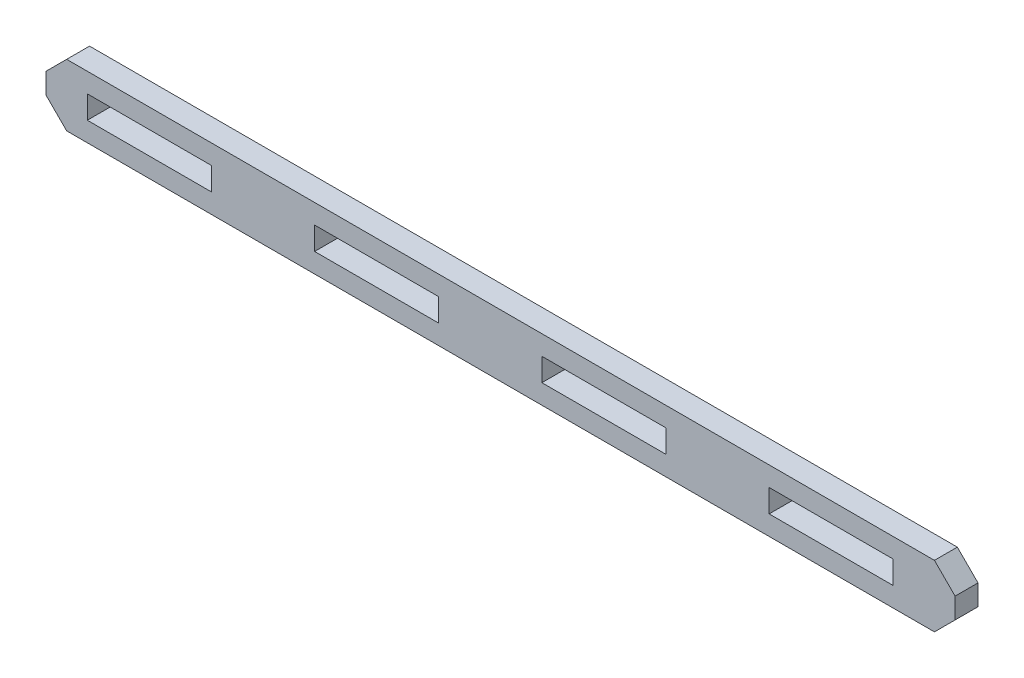
from build123d import *

# Parameters (mm, degrees)
SKETCH2_W           = 30
SKETCH2_H           = 5.54
BOSS_EXTRUDE1_DEPTH = 5.54


with BuildPart() as part:
    # Sketch2 → Boss-Extrude1 (new body)
    with BuildSketch(Plane.XY):
        Polygon((60.854830423, 15.146039761), (270.854830423, 15.146039761), (275.854830423, 10.146039761), (275.854830423, 5.146039761), (270.854830423, 0.146039761), (60.854830423, 0.146039761), (55.854830423, 5.146039761), (55.854830423, 10.146039761), align=None)
        with Locations((135.854830423, 7.646039761)):
            Rectangle(SKETCH2_W, SKETCH2_H, mode=Mode.SUBTRACT)
        with Locations((80.854830423, 7.646039761)):
            Rectangle(SKETCH2_W, SKETCH2_H, mode=Mode.SUBTRACT)
        with Locations((190.854830423, 7.646039761)):
            Rectangle(SKETCH2_W, SKETCH2_H, mode=Mode.SUBTRACT)
        with Locations((245.854830423, 7.646039761)):
            Rectangle(SKETCH2_W, SKETCH2_H, mode=Mode.SUBTRACT)
    extrude(amount=BOSS_EXTRUDE1_DEPTH)


solid = part.part
